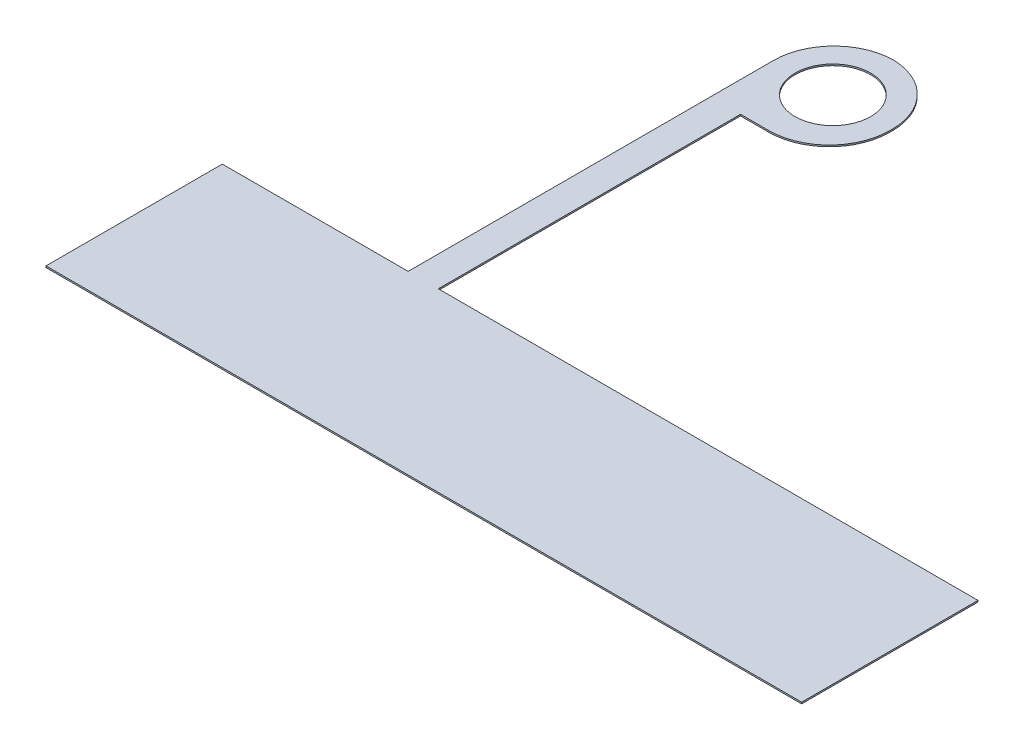
from build123d import *

# Parameters (mm, degrees)
SKETCH1_W           = 15
SKETCH1_H           = 3.5
SKETCH1_W_2         = 0.598
SKETCH1_H_2         = 6
BOSS_EXTRUDE1_DEPTH = 0.03
FILLET1_R           = 1.2
SKETCH2_R           = 0.75
CUT_EXTRUDE1_DEPTH  = 1


with BuildPart() as part:
    # Sketch1 → Boss-Extrude1 (new body)
    with BuildSketch(Plane(origin=(0, 0, 0), x_dir=(1, 0, 0), z_dir=(0, 1, 0))):
        with Locations((7.5, 1.75)):
            Rectangle(SKETCH1_W, SKETCH1_H)
        with Locations((3.988, 6.5)):
            Rectangle(SKETCH1_W_2, SKETCH1_H_2)
        Polygon((3.689, 11.95), (3.689, 9.5), (4.287, 9.5), (6.049, 9.5), (6.049, 11.95), align=None)
    extrude(amount=BOSS_EXTRUDE1_DEPTH)

    # Fillet1
    # the kernel refuses this fillet: 1.2 mm, written as the material it takes off along each edge
    with BuildSketch(Plane(origin=(3.689, -3, -11.95), x_dir=(0, 0, 1), z_dir=(0, 1, 0)), Plane(origin=(6.049, -3, -11.95), x_dir=(-1, 0, 0), z_dir=(0, 1, 0)), Plane(origin=(6.049, -3, -9.5), x_dir=(0, 0, -1), z_dir=(0, 1, 0))) as fillet1_piece_1:
        with BuildLine():
            CenterArc((FILLET1_R, FILLET1_R), FILLET1_R, 180, 90)
            Line((0, FILLET1_R), (0, 0))
            Line((0, 0), (FILLET1_R, 0))
        make_face()
    extrude(amount=6.03, mode=Mode.SUBTRACT)

    # Sketch2 → Cut-Extrude1 (cut)
    with BuildSketch(Plane(origin=(0, 0.03, 0), x_dir=(1, 0, 0), z_dir=(0, 1, 0))):
        with Locations(Location((4.869, 10.75, 0), (0, 0, 270))):
            Circle(SKETCH2_R)
    extrude(amount=-CUT_EXTRUDE1_DEPTH, mode=Mode.SUBTRACT)


solid = part.part
